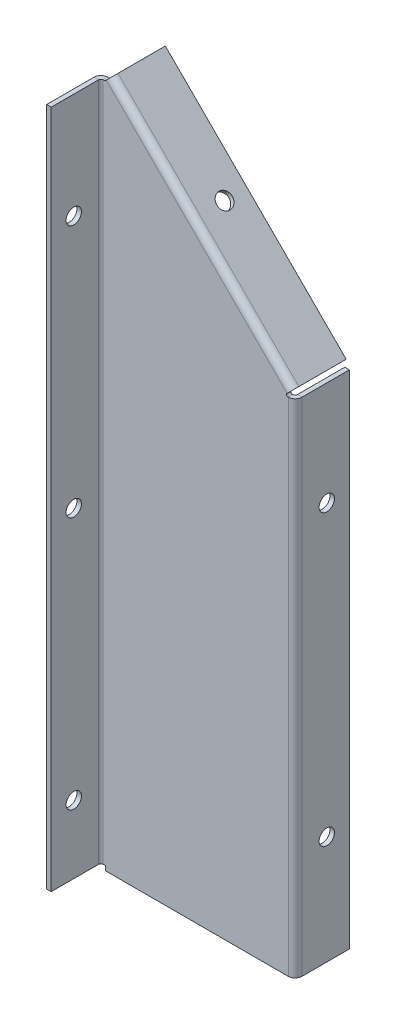
from build123d import *

# Parameters (mm, degrees)
BASE_FLANGE1_DEPTH           = 1.6002
EDGE_FLANGE1_STRIP_W         = 8.0264
EDGE_FLANGE1_STRIP_H         = 1.6002
EDGE_FLANGE1_STRIP_CUT_DEPTH = 176.239897552
EDGE_FLANGE1_DEPTH           = 176.239897552
EDGE_FLANGE2_STRIP_W         = 8.0264
EDGE_FLANGE2_STRIP_H         = 1.6002
EDGE_FLANGE2_STRIP_CUT_DEPTH = 89.864191945
EDGE_FLANGE2_DEPTH           = 89.864191945
EDGE_FLANGE3_STRIP_W         = 8.0264
EDGE_FLANGE3_STRIP_H         = 1.6002
EDGE_FLANGE3_STRIP_CUT_DEPTH = 238.716677062
EDGE_FLANGE3_DEPTH           = 238.716677062
SKETCH18_R                   = 2.7051
CUT_EXTRUDE3_DEPTH           = 7.62
SKETCH19_R                   = 2.7051
CUT_EXTRUDE4_DEPTH           = 7.62
SKETCH20_R                   = 2.7051
CUT_EXTRUDE5_DEPTH           = 7.62


# Read off the part's stored shape, not the designer's step: Base-Flange1
# Sheet-metal steps are written as plain solids
with BuildPart() as part:
    # Base-Flange1 outline → Base-Flange1 (new body)
    with BuildSketch(Plane(origin=(0, 0, 0), x_dir=(1, 0, 0), z_dir=(0, 0, -1))):
        with BuildLine():
            Line((0, 0), (-66.675, 0))
            Line((-66.675, 0), (-66.675, -1.5748))
            Line((-66.675, -1.5748), (-69.85, -1.5748))
            Line((-69.85, -1.5748), (-69.85, -240.291477062))
            Line((-69.85, -240.291477062), (-66.802, -240.291477062))
            Line((-66.802, -240.291477062), (-64.646738531, -242.446738531))
            Line((-64.646738531, -242.446738531), (-1.103159021, -178.903159021))
            Line((-1.103159021, -178.903159021), (-2.899210245, -177.107107796))
            ThreePointArc((-2.899210245, -177.107107796), (-3.009330803, -176.553494368), (-2.54, -176.239897552))
            Line((-2.54, -176.239897552), (0, -176.239897552))
            Line((0, -176.239897552), (0, 0))
        make_face()
    extrude(amount=BASE_FLANGE1_DEPTH)

    # Edge-Flange1 strip (across the edge) → Edge-Flange1 strip cut (cut)
    with BuildSketch(Plane(origin=(0, 176.239897552, -1.6002), x_dir=(-1, 0, 0), z_dir=(0, -1, 0))):
        with Locations((-1.6002, -0.8001)):
            Rectangle(EDGE_FLANGE1_STRIP_W, EDGE_FLANGE1_STRIP_H)
    extrude(amount=EDGE_FLANGE1_STRIP_CUT_DEPTH, mode=Mode.SUBTRACT)

    # Edge-Flange1 section (across the edge) → Edge-Flange1 (add)
    with BuildSketch(Plane(origin=(0, 176.239897552, -1.6002), x_dir=(-1, 0, 0), z_dir=(0, -1, 0))):
        with BuildLine():
            Line((0, 0.8128), (0, 17.4498))
            Line((0, 17.4498), (1.6002, 17.4498))
            Line((1.6002, 17.4498), (1.6002, 0.8128))
            ThreePointArc((1.6002, 0.8128), (1.838263608, 0.238063608), (2.413, 0))
            Line((2.413, 0), (2.413, -1.6002))
            ThreePointArc((2.413, -1.6002), (0.706751337, -0.893448663), (0, 0.8128))
        make_face()
    extrude(amount=EDGE_FLANGE1_DEPTH)

    # Edge-Flange2 strip (across the edge) → Edge-Flange2 strip cut (cut)
    with BuildSketch(Plane(origin=(-64.646738531, 242.446738531, -1.6002), x_dir=(-0.7071067811865479, -0.7071067811865472, -3.58046925441613e-15), z_dir=(0.7071067811865472, -0.7071067811865479, 0))):
        with Locations((-1.6002, -0.8001)):
            Rectangle(EDGE_FLANGE2_STRIP_W, EDGE_FLANGE2_STRIP_H)
    extrude(amount=EDGE_FLANGE2_STRIP_CUT_DEPTH, mode=Mode.SUBTRACT)

    # Edge-Flange2 section (across the edge) → Edge-Flange2 (add)
    with BuildSketch(Plane(origin=(-64.646738531, 242.446738531, -1.6002), x_dir=(-0.7071067811865479, -0.7071067811865472, -3.58046925441613e-15), z_dir=(0.7071067811865472, -0.7071067811865479, 0))):
        with BuildLine():
            Line((0, 0.8128), (0, 17.4498))
            Line((0, 17.4498), (1.6002, 17.4498))
            Line((1.6002, 17.4498), (1.6002, 0.8128))
            ThreePointArc((1.6002, 0.8128), (1.838263608, 0.238063608), (2.413, 0))
            Line((2.413, 0), (2.413, -1.6002))
            ThreePointArc((2.413, -1.6002), (0.706751337, -0.893448663), (0, 0.8128))
        make_face()
    extrude(amount=EDGE_FLANGE2_DEPTH)

    # Edge-Flange3 strip (across the edge) → Edge-Flange3 strip cut (cut)
    with BuildSketch(Plane(origin=(-69.85, 240.291477062, 0), x_dir=(1, 0, 0), z_dir=(0, -1, 0))):
        with Locations((-1.6002, -0.8001)):
            Rectangle(EDGE_FLANGE3_STRIP_W, EDGE_FLANGE3_STRIP_H)
    extrude(amount=EDGE_FLANGE3_STRIP_CUT_DEPTH, mode=Mode.SUBTRACT)

    # Edge-Flange3 section (across the edge) → Edge-Flange3 (add)
    with BuildSketch(Plane(origin=(-69.85, 240.291477062, 0), x_dir=(1, 0, 0), z_dir=(0, -1, 0))):
        with BuildLine():
            Line((0, 0.8128), (0, 17.4498))
            Line((0, 17.4498), (1.6002, 17.4498))
            Line((1.6002, 17.4498), (1.6002, 0.8128))
            ThreePointArc((1.6002, 0.8128), (1.838263608, 0.238063608), (2.413, 0))
            Line((2.413, 0), (2.413, -1.6002))
            ThreePointArc((2.413, -1.6002), (0.706751337, -0.893448663), (0, 0.8128))
        make_face()
    extrude(amount=EDGE_FLANGE3_DEPTH)

    # Sketch18 → Cut-Extrude3 (cut)
    with BuildSketch(Plane(origin=(0, 0, 0), x_dir=(0, 0, -1), z_dir=(1, 0, 0))):
        with Locations((11.1252, 38.1)):
            Circle(SKETCH18_R)
        with Locations((11.1252, 139.7)):
            Circle(SKETCH18_R)
    extrude(amount=-CUT_EXTRUDE3_DEPTH, mode=Mode.SUBTRACT)

    # Sketch19 → Cut-Extrude4 (cut)
    with BuildSketch(Plane(origin=(88.9, 88.9, 0), x_dir=(0, 0, -1), z_dir=(0.7071067811865517, 0.7071067811865434, 3.37416286723297e-15))):
        with Locations(Location((11.1252, 176.523585695, 0), (0, 0, 90))):
            Circle(SKETCH19_R)
    extrude(amount=-CUT_EXTRUDE4_DEPTH, mode=Mode.SUBTRACT)

    # Sketch20 → Cut-Extrude5 (cut)
    with BuildSketch(Plane.ZY.offset(69.85)):
        with Locations((9.525, 25.4)):
            Circle(SKETCH20_R)
        with Locations((9.525, 114.3)):
            Circle(SKETCH20_R)
        with Locations((9.525, 203.2)):
            Circle(SKETCH20_R)
    extrude(amount=-CUT_EXTRUDE5_DEPTH, mode=Mode.SUBTRACT)


solid = part.part
